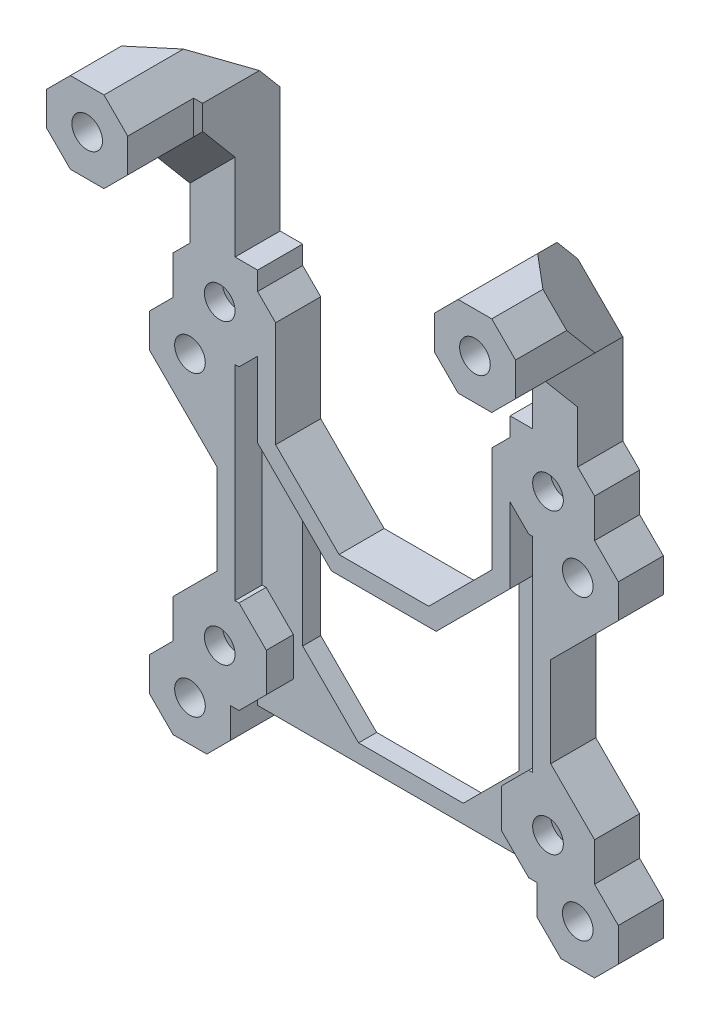
from build123d import *
from OCP.BRepFilletAPI import BRepFilletAPI_MakeChamfer

# Parameters (mm, degrees)
SKETCH5_R           = 1.7
BOSS_EXTRUDE1_DEPTH = 2
SKETCH9_R           = 1.7
BOSS_EXTRUDE3_DEPTH = 3
BOSS_EXTRUDE4_DEPTH = 3.6
BOSS_EXTRUDE5_DEPTH = 7.8
TOP_ANGLE_1_DEPTH   = 25
TOP_ANGLE_2_DEPTH   = 25
CHAMFER1_SIZE       = 3
CHAMFER1_SIZE_2     = 3.575260778
CHAMFER2_SIZE       = 1.8
CHAMFER2_SIZE2      = 2.145156467
SKETCH19_R          = 1.7
CUT_EXTRUDE1_DEPTH  = 3.75
M3_HEAD_HOLES_DEPTH = 3
CHAMFER3_SIZE       = 0.5


# Some blends are built 0.0001 mm under size
with BuildPart() as part:
    # Sketch5 → Boss-Extrude1 (new body)
    with BuildSketch(Plane.XY):
        Polygon((16.5, 44.802943725), (16.5, 45.24192642), (16.5, 61.363961031), (17, 61.863961031), (19.636038969, 64.5), (23.363961031, 64.5), (26, 61.863961031), (26, 58.136038969), (23.363961031, 55.5), (21.5, 53.636038969), (21.5, 43.64192642), (23.363961031, 41.777965389), (23.363961031, 37.5), (26, 34.863961031), (26, 31.136038969), (23.363961031, 28.5), (18.5, 23.636038969), (18.5, 13.64192642), (20.338982694, 11.802943725), (23.363961031, 8.777965389), (23.363961031, 4.5), (26, 1.863961031), (26, -1.863961031), (23.363961031, -4.5), (19.636038969, -4.5), (17, -1.863961031), (17, 0), (-17, 0), (-17, -1.863961031), (-19.636038969, -4.5), (-23.363961031, -4.5), (-26, -1.863961031), (-26, 1.863961031), (-23.363961031, 4.5), (-23.363961031, 8.777965389), (-20.338982694, 11.802943725), (-18.5, 13.64192642), (-18.5, 23.636038969), (-23.363961031, 28.5), (-26, 31.136038969), (-26, 34.863961031), (-23.363961031, 37.5), (-23.363961031, 41.777965389), (-21.5, 43.64192642), (-21.5, 53.636038969), (-23.363961031, 55.5), (-26, 58.136038969), (-26, 61.863961031), (-23.363961031, 64.5), (-19.636038969, 64.5), (-17, 61.863961031), (-16.5, 61.363961031), (-16.5, 60), (-16.5, 44.802943725), (-16.061017306, 44.802943725), (-14, 44.802943725), (-14, 42.74192642), (-13.036038969, 41.777965389), (-12, 40.74192642), (-12, 29.029437252), (-4.970562748, 22), (4.970562748, 22), (12, 29.029437252), (12, 40.74192642), (13.036038969, 41.777965389), (14, 42.74192642), (14, 44.802943725), (16.061017306, 44.802943725), align=None)
        with Locations((-18.2, 6.638982694)):
            Circle(SKETCH5_R, mode=Mode.SUBTRACT)
        with Locations((-18.2, 39.638982694)):
            Circle(SKETCH5_R, mode=Mode.SUBTRACT)
        with Locations(Location((18.2, 39.638982694, 0), (0, 0, 180))):
            Circle(SKETCH5_R, mode=Mode.SUBTRACT)
        with Locations(Location((18.2, 6.638982694, 0), (0, 0, 180))):
            Circle(SKETCH5_R, mode=Mode.SUBTRACT)
        Polygon((5.798989873, 2), (-5.798989873, 2), (-12, 8.201010127), (-12, 26.201010127), (-5.798989873, 20), (5.798989873, 20), (12, 26.201010127), (12, 8.201010127), align=None, mode=Mode.SUBTRACT)
    extrude(amount=BOSS_EXTRUDE1_DEPTH)

    # Sketch9 → Boss-Extrude3 (add)
    with BuildSketch(Plane.XY.offset(2)):
        Polygon((-19.636038969, -4.5), (-17, -1.863961031), (-17, 1.475021664), (-16.061017306, 1.475021664), (-13.036038969, 4.5), (-13.036038969, 8.777965389), (-16.061017306, 11.802943725), (-16.5, 11.802943725), (-16.5, 34.363961031), (-16.5, 34.475021664), (-16.061017306, 34.475021664), (-14, 36.536038969), (-14, 28.201010127), (-12, 26.201010127), (-5.798989873, 20), (5.798989873, 20), (12, 26.201010127), (14, 28.201010127), (14, 36.536038969), (16.061017306, 34.475021664), (16.5, 34.475021664), (16.5, 34.363961031), (16.5, 11.802943725), (16.061017306, 11.802943725), (13.036038969, 8.777965389), (13.036038969, 4.5), (16.061017306, 1.475021664), (17, 1.475021664), (17, -1.863961031), (19.636038969, -4.5), (23.363961031, -4.5), (26, -1.863961031), (26, 1.863961031), (23.363961031, 4.5), (23.363961031, 8.777965389), (20.338982694, 11.802943725), (18.5, 13.64192642), (18.5, 23.636038969), (23.363961031, 28.5), (26, 31.136038969), (26, 34.863961031), (23.363961031, 37.5), (23.363961031, 41.777965389), (21.5, 43.64192642), (21.5, 53.636038969), (23.363961031, 55.5), (26, 58.136038969), (26, 61.863961031), (23.363961031, 64.5), (19.636038969, 64.5), (17, 61.863961031), (16.5, 61.363961031), (16.5, 45.24192642), (16.5, 44.802943725), (16.061017306, 44.802943725), (14, 44.802943725), (14, 42.74192642), (13.036038969, 41.777965389), (12, 40.74192642), (12, 29.029437252), (4.970562748, 22), (-4.970562748, 22), (-12, 29.029437252), (-12, 40.74192642), (-13.036038969, 41.777965389), (-14, 42.74192642), (-14, 44.802943725), (-16.061017306, 44.802943725), (-16.5, 44.802943725), (-16.5, 60), (-16.5, 61.363961031), (-17, 61.863961031), (-19.636038969, 64.5), (-23.363961031, 64.5), (-26, 61.863961031), (-26, 58.136038969), (-23.363961031, 55.5), (-21.5, 53.636038969), (-21.5, 43.64192642), (-23.363961031, 41.777965389), (-23.363961031, 37.5), (-26, 34.863961031), (-26, 31.136038969), (-23.363961031, 28.5), (-18.5, 23.636038969), (-18.5, 13.64192642), (-20.338982694, 11.802943725), (-23.363961031, 8.777965389), (-23.363961031, 4.5), (-26, 1.863961031), (-26, -1.863961031), (-23.363961031, -4.5), align=None)
        with Locations((-21.5, 33)):
            Circle(SKETCH9_R, mode=Mode.SUBTRACT)
        with Locations((-18.2, 39.638982694)):
            Circle(SKETCH9_R, mode=Mode.SUBTRACT)
        with Locations((-21.5, 0)):
            Circle(SKETCH9_R, mode=Mode.SUBTRACT)
        with Locations((-18.2, 6.638982694)):
            Circle(SKETCH9_R, mode=Mode.SUBTRACT)
        with Locations(Location((18.2, 6.638982694, 0), (0, 0, 180))):
            Circle(SKETCH9_R, mode=Mode.SUBTRACT)
        with Locations(Location((21.5, 0, 0), (0, 0, 180))):
            Circle(SKETCH9_R, mode=Mode.SUBTRACT)
        with Locations(Location((18.2, 39.638982694, 0), (0, 0, 180))):
            Circle(SKETCH9_R, mode=Mode.SUBTRACT)
        with Locations(Location((21.5, 33, 0), (0, 0, 180))):
            Circle(SKETCH9_R, mode=Mode.SUBTRACT)
    extrude(amount=BOSS_EXTRUDE3_DEPTH)

    # Sketch10 → Boss-Extrude4 (add)
    with BuildSketch(Plane.XY.offset(5)):
        Polygon((17, 58.136038969), (16.5, 58.636038969), (16.5, 61.363961031), (17, 61.863961031), (19.636038969, 64.5), (23.363961031, 64.5), (26, 61.863961031), (26, 58.136038969), (23.363961031, 55.5), (21.5, 53.636038969), (19.636038969, 55.5), align=None)
        Polygon((-17, 61.863961031), (-19.636038969, 64.5), (-23.363961031, 64.5), (-26, 61.863961031), (-26, 58.136038969), (-23.363961031, 55.5), (-21.5, 53.636038969), (-19.636038969, 55.5), (-17, 58.136038969), (-16.5, 58.636038969), (-16.5, 61.363961031), align=None)
    extrude(amount=BOSS_EXTRUDE4_DEPTH)

    # Sketch20 → Boss-Extrude5 (add)
    with BuildSketch(Plane.XY.offset(8.6)):
        Polygon((-17, 58.136038969), (-17, 61.863961031), (-19.636038969, 64.5), (-23.363961031, 64.5), (-26, 61.863961031), (-26, 58.136038969), (-23.363961031, 55.5), (-19.636038969, 55.5), align=None)
        Polygon((17, 61.863961031), (19.636038969, 64.5), (23.363961031, 64.5), (26, 61.863961031), (26, 58.136038969), (23.363961031, 55.5), (19.636038969, 55.5), (17, 58.136038969), align=None)
    extrude(amount=BOSS_EXTRUDE5_DEPTH)

    # Sketch15 → Top Angle 1 (cut, symmetric)
    with BuildSketch(Plane(origin=(19.25, 19.25, 0), x_dir=(0, 0, -1), z_dir=(0.7071067811865485, 0.7071067811865467, 0))):
        Polygon((0, 53.129202667), (-15.320888862, 65.98495486), (-8.893012766, 73.645399292), (6.427876097, 60.789647098), align=None)
    extrude(amount=TOP_ANGLE_1_DEPTH, both=True, mode=Mode.SUBTRACT)

    # Sketch16 → Top Angle 2 (cut, symmetric)
    with BuildSketch(Plane(origin=(-19.25, 19.25, 0), x_dir=(0.7071067811865475, 0.7071067811865477, 0), z_dir=(-0.7071067811865477, 0.7071067811865475, 0))):
        Polygon((53.129202667, 0), (65.98495486, -15.320888862), (73.645399292, -8.893012766), (60.789647098, 6.427876097), align=None)
    extrude(amount=TOP_ANGLE_2_DEPTH, both=True, mode=Mode.SUBTRACT)

    # Chamfer1
    # the kernel refuses this chamfer: 3.575260778, 3 mm, written as the material it adds along each edge
    with BuildSketch(Plane(origin=(-28.015917535, 47.120121434, 5), x_dir=(0.7066633444206492, -0.7066633444206532, -0.03540953691366292), z_dir=(0.7071067811865496, 0.7071067811865456, 0))) as chamfer1_piece_1_section:
        Polygon((CHAMFER1_SIZE * 0.999372885712, -CHAMFER1_SIZE * 0.0354095369137), (-CHAMFER1_SIZE_2 * 0.0354095369115, -CHAMFER1_SIZE_2 * 0.999372885651), (0, 0), align=None)
    chamfer1_piece_1 = extrude(amount=25.500865711, mode=Mode.PRIVATE)
    chamfer1_piece_1 = split(chamfer1_piece_1, bisect_by=Plane(origin=(-21.5, 51.974230038, 5.812222145), z_dir=(1, 0, 0)), keep=Keep.TOP, mode=Mode.PRIVATE)
    chamfer1_piece_1 = split(chamfer1_piece_1, bisect_by=Plane(origin=(-20.392127379, 52.528166349, 5.812222145), z_dir=(-0.7071067811865449, -0.7071067811865502, 0)), keep=Keep.TOP, mode=Mode.PRIVATE)
    add(chamfer1_piece_1)
    with BuildSketch(Plane(origin=(-21.5, 53.636038969, 5), x_dir=(0.7066633444206492, -0.7066633444206532, -0.03540953691366292), z_dir=(0.7071067811865496, 0.7071067811865456, 0))) as chamfer1_piece_2_section:
        Polygon((CHAMFER1_SIZE * 0.999372885712, -CHAMFER1_SIZE * 0.0354095369137), (-CHAMFER1_SIZE_2 * 0.0354095369115, -CHAMFER1_SIZE_2 * 0.999372885651), (0, 0), align=None)
    chamfer1_piece_2 = extrude(amount=16.285966762, mode=Mode.PRIVATE)
    chamfer1_piece_2 = split(chamfer1_piece_2, bisect_by=Plane(origin=(-21.5, 55.195385709, 6.244922793), z_dir=(1, 0, 0)), keep=Keep.TOP, mode=Mode.PRIVATE)
    chamfer1_piece_2 = split(chamfer1_piece_2, bisect_by=Plane(origin=(-16.5, 55.195385709, 6.244922793), z_dir=(-1, 0, 0)), keep=Keep.TOP, mode=Mode.PRIVATE)
    add(chamfer1_piece_2)
    with BuildSketch(Plane(origin=(9.984082465, 65.151956505, 5), x_dir=(0.017634763768199533, 0.01763476376819963, 0.9996889667359942), z_dir=(0.7071067811865496, -0.7071067811865456, 0))) as chamfer1_piece_3_section:
        Polygon((CHAMFER1_SIZE_2 * 0.999688966675, CHAMFER1_SIZE_2 * 0.0249393220887), (-CHAMFER1_SIZE * 0.0249393220902, CHAMFER1_SIZE * 0.999688966736), (0, 0), align=None)
    chamfer1_piece_3 = extrude(amount=16.285966762, mode=Mode.PRIVATE)
    chamfer1_piece_3 = split(chamfer1_piece_3, bisect_by=Plane(origin=(16.5, 55.195385709, 6.244922793), z_dir=(1, 0, 0)), keep=Keep.TOP, mode=Mode.PRIVATE)
    chamfer1_piece_3 = split(chamfer1_piece_3, bisect_by=Plane(origin=(21.5, 55.195385709, 6.244922793), z_dir=(-1, 0, 0)), keep=Keep.TOP, mode=Mode.PRIVATE)
    add(chamfer1_piece_3)
    with BuildSketch(Plane(origin=(9.984082465, 65.151956505, 5), x_dir=(0.017634763768199533, 0.01763476376819963, 0.9996889667359942), z_dir=(0.7071067811865496, -0.7071067811865456, 0))) as chamfer1_piece_4_section:
        Polygon((CHAMFER1_SIZE_2 * 0.999688966675, CHAMFER1_SIZE_2 * 0.0249393220887), (-CHAMFER1_SIZE * 0.0249393220902, CHAMFER1_SIZE * 0.999688966736), (0, 0), align=None)
    chamfer1_piece_4 = extrude(amount=25.500865711, mode=Mode.PRIVATE)
    chamfer1_piece_4 = split(chamfer1_piece_4, bisect_by=Plane(origin=(20.392127379, 52.528166349, 5.812222145), z_dir=(0.707106781186548, -0.707106781186547, 0)), keep=Keep.TOP, mode=Mode.PRIVATE)
    chamfer1_piece_4 = split(chamfer1_piece_4, bisect_by=Plane(origin=(21.5, 51.974230038, 5.812222145), z_dir=(-1, 0, 0)), keep=Keep.TOP, mode=Mode.PRIVATE)
    add(chamfer1_piece_4)

    # Chamfer2: one chamfer whose edges measure the first distance from different faces: ONE call of the kernel's chamfer builder (chamfer() names one face for all edges)
    chamfer2_edges_1 = [part.edges().sort_by_distance(p)[0] for p in [
        (21.5, 55.5, 8.6),
    ]]
    chamfer2_side_1 = [part.faces().sort_by_distance(p)[0] for p in [
        (21.5, 54.878679656, 8.6),
    ]]
    chamfer2_edges_2 = [part.edges().sort_by_distance(p)[0] for p in [
        (-21.5, 55.5, 8.6),
    ]]
    chamfer2_side_2 = [part.faces().sort_by_distance(p)[0] for p in [
        (-21.5, 54.878679656, 8.6),
    ]]
    chamfer2 = BRepFilletAPI_MakeChamfer(part.part.solid().wrapped)
    for e in chamfer2_edges_1:
        chamfer2.Add(CHAMFER2_SIZE, CHAMFER2_SIZE2, e.wrapped, chamfer2_side_1[0].wrapped)  # the first distance lies on this face
    for e in chamfer2_edges_2:
        chamfer2.Add(CHAMFER2_SIZE, CHAMFER2_SIZE2, e.wrapped, chamfer2_side_2[0].wrapped)  # the first distance lies on this face
    add(Compound.cast(chamfer2.Shape()), mode=Mode.REPLACE)

    # Sketch19 → Cut-Extrude1 (cut)
    with BuildSketch(Plane.XY.offset(16.4)):
        with Locations((-21.5, 60)):
            Circle(SKETCH19_R)
        with Locations((21.5, 60)):
            Circle(SKETCH19_R)
    extrude(amount=-CUT_EXTRUDE1_DEPTH, mode=Mode.SUBTRACT)

    # Sketch18 → M3 Head Holes (cut)
    with BuildSketch(Plane(origin=(0, 0, 0), x_dir=(-1, 0, 0), z_dir=(0, 0, -1))):
        Polygon((16.496816706, 42.588982694), (19.903183294, 42.588982694), (21.606366588, 39.638982694), (19.903183294, 36.688982694), (16.496816706, 36.688982694), (14.793633412, 39.638982694), align=None)
        Polygon((19.903183294, 9.588982694), (21.606366588, 6.638982694), (19.903183294, 3.688982694), (16.496816706, 3.688982694), (14.793633412, 6.638982694), (16.496816706, 9.588982694), align=None)
        Polygon((-21.606366588, 6.638982694), (-19.903183294, 3.688982694), (-16.496816706, 3.688982694), (-14.793633412, 6.638982694), (-16.496816706, 9.588982694), (-19.903183294, 9.588982694), align=None)
        Polygon((-14.793633412, 39.638982694), (-16.496816706, 42.588982694), (-19.903183294, 42.588982694), (-21.606366588, 39.638982694), (-19.903183294, 36.688982694), (-16.496816706, 36.688982694), align=None)
    extrude(amount=-M3_HEAD_HOLES_DEPTH, mode=Mode.SUBTRACT)

    # Chamfer3
    chamfer3_edges = [part.edges().sort_by_distance(p)[0] for p in [
        (17, 60, 8.6),
        (-17, 60, 8.6),
    ]]
    chamfer(chamfer3_edges, length=CHAMFER3_SIZE - 0.0001)  # a hair under: the kernel refuses the full size


solid = part.part
